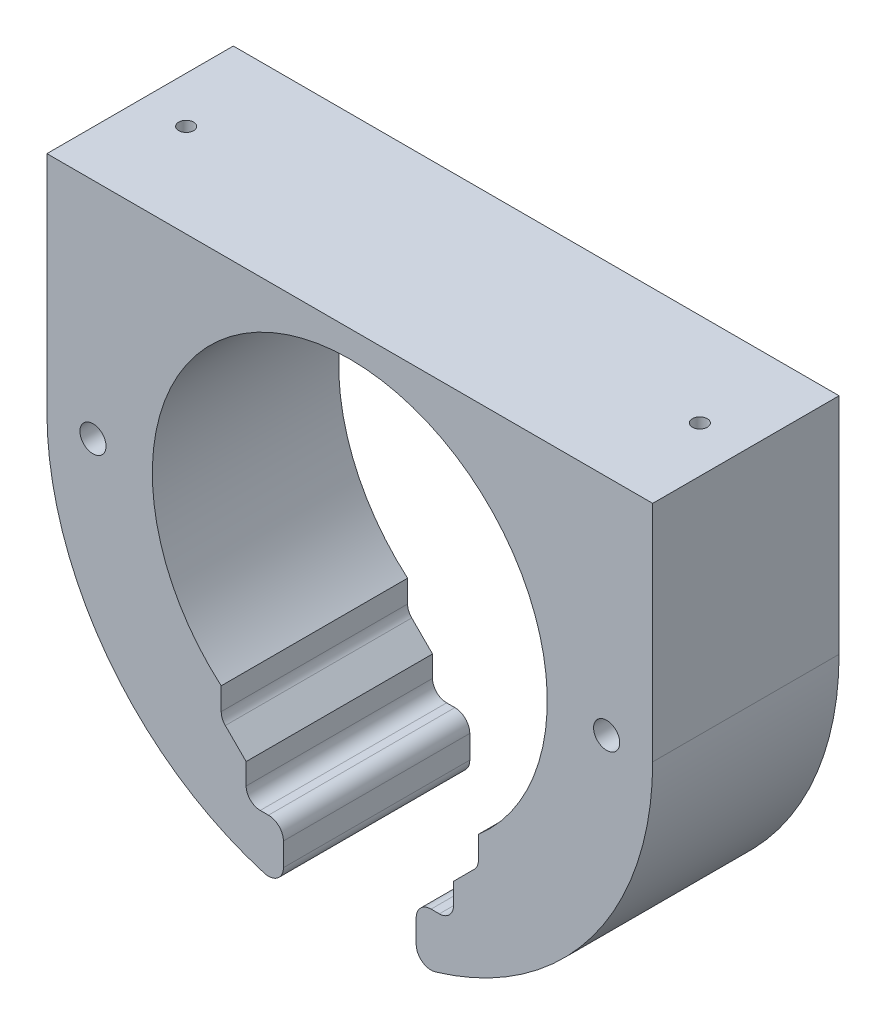
from build123d import *

# Parameters (mm, degrees)
SKETCH1_R           = 0.889
BOSS_EXTRUDE1_DEPTH = 12.7
SKETCH2_R           = 0.508
CUT_EXTRUDE1_DEPTH  = 12.7


with BuildPart() as part:
    # Sketch1 → Boss-Extrude1 (new body)
    with BuildSketch(Plane.XY):
        with BuildLine():
            Line((-20.6375, -7.688584311), (-20.6375, 7.567266813))
            Line((-20.6375, 7.567266813), (20.6375, 7.567266813))
            Line((20.6375, 7.567266813), (20.6375, -7.688584311))
            ThreePointArc((20.6375, -7.688584311), (16.525068691, -20.050967212), (5.826741818, -27.486450005))
            ThreePointArc((5.826741818, -27.486450005), (4.931277216, -27.325327691), (4.523886836, -26.511785848))
            Line((4.523886836, -26.511785848), (4.523886836, -24.938668143))
            ThreePointArc((4.523886836, -24.938668143), (4.821466346, -24.220247653), (5.539886836, -23.922668143))
            Line((5.539886836, -23.922668143), (6.102813797, -23.922668143))
            ThreePointArc((6.102813797, -23.922668143), (6.78239506, -23.641176367), (7.063886836, -22.961595104))
            Line((7.063886836, -22.961595104), (7.063886836, -21.519985546))
            Line((7.063886836, -21.519985546), (8.481348217, -20.102524164))
            ThreePointArc((8.481348217, -20.102524164), (8.689682664, -19.79072963), (8.762839993, -19.422942901))
            Line((8.762839993, -19.422942901), (8.762839993, -17.898886311))
            ThreePointArc((8.762839993, -17.898886311), (11.420440685, -14.802736841), (13.027769559, -11.052339947))
            ThreePointArc((13.027769559, -11.052339947), (13.455022544, -7.688584311), (13.027769559, -4.324828675))
            ThreePointArc((13.027769559, -4.324828675), (0, 5.766438233), (-13.027769559, -4.324828675))
            ThreePointArc((-13.027769559, -4.324828675), (-13.455022544, -7.688584311), (-13.027769559, -11.052339947))
            ThreePointArc((-13.027769559, -11.052339947), (-11.420440685, -14.802736841), (-8.762839993, -17.898886311))
            Line((-8.762839993, -17.898886311), (-8.762839993, -19.422942901))
            ThreePointArc((-8.762839993, -19.422942901), (-8.689682664, -19.79072963), (-8.481348217, -20.102524164))
            Line((-8.481348217, -20.102524164), (-7.063886836, -21.519985546))
            Line((-7.063886836, -21.519985546), (-7.063886836, -22.961595104))
            ThreePointArc((-7.063886836, -22.961595104), (-6.78239506, -23.641176367), (-6.102813797, -23.922668143))
            Line((-6.102813797, -23.922668143), (-5.539886836, -23.922668143))
            ThreePointArc((-5.539886836, -23.922668143), (-4.821466346, -24.220247653), (-4.523886836, -24.938668143))
            Line((-4.523886836, -24.938668143), (-4.523886836, -26.511785848))
            ThreePointArc((-4.523886836, -26.511785848), (-4.931277216, -27.325327691), (-5.826741818, -27.486450005))
            ThreePointArc((-5.826741818, -27.486450005), (-16.525068691, -20.050967212), (-20.6375, -7.688584311))
        make_face()
        with Locations((-17.5, -7.688584311)):
            Circle(SKETCH1_R, mode=Mode.SUBTRACT)
        with Locations((17.5, -7.688584311)):
            Circle(SKETCH1_R, mode=Mode.SUBTRACT)
    extrude(amount=BOSS_EXTRUDE1_DEPTH)

    # Sketch2 → Cut-Extrude1 (cut)
    with BuildSketch(Plane(origin=(0, 7.567266813, 0), x_dir=(1, 0, 0), z_dir=(0, 1, 0))):
        with Locations((-17.5, -6.35)):
            Circle(SKETCH2_R)
        with Locations((17.5, -6.35)):
            Circle(SKETCH2_R)
    extrude(amount=-CUT_EXTRUDE1_DEPTH, mode=Mode.SUBTRACT)


solid = part.part
